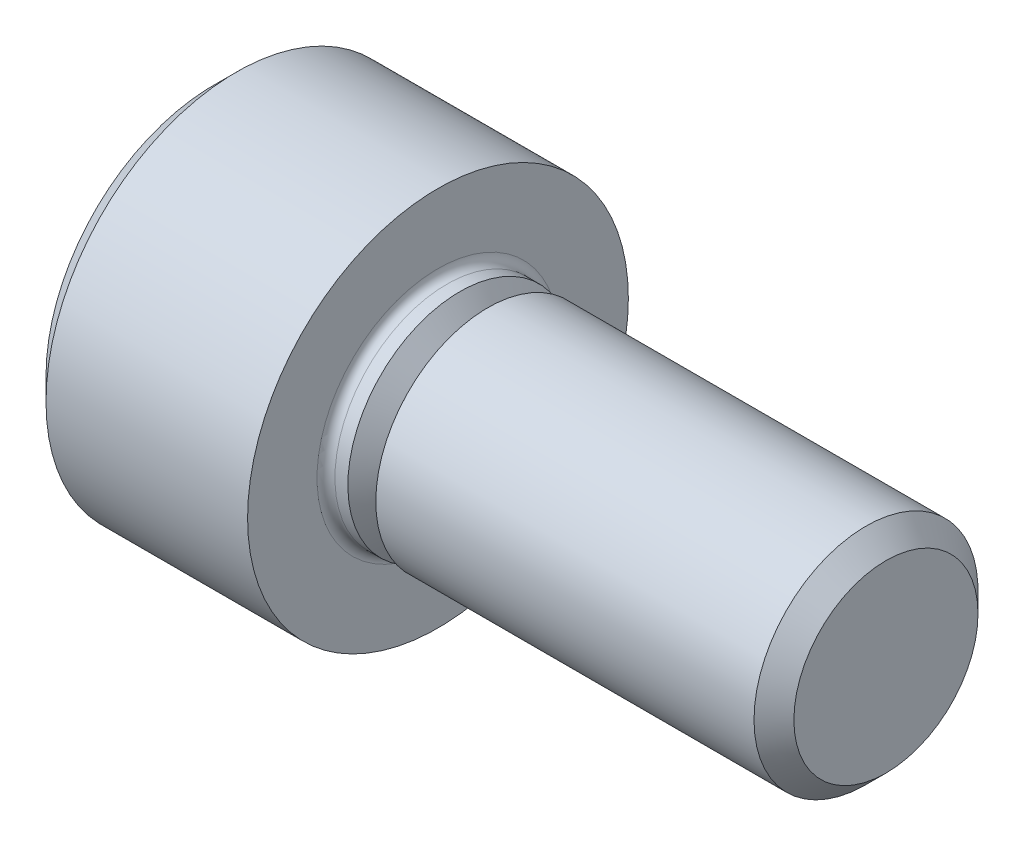
from build123d import *

# Parameters (mm, degrees)
FILLET1_R   = 0.2
HEX_2_DEPTH = 2.5


with BuildPart() as part:
    # BodySke → Base-Revolve (revolve)
    with BuildSketch(Plane.XY):
        Polygon((0, 0), (0, 3.75), (0.5, 4.25), (5, 4.25), (5, 2.5), (14.555, 2.5), (15, 2.055), (15, 0), align=None)
    revolve(axis=Axis((-31.75, 0, 0), (1, 0, 0)))

    # Fillet1
    fillet1_edges = [part.edges().sort_by_distance(p)[0] for p in [
        (5, -2.5, 0),
    ]]
    fillet(fillet1_edges, radius=FILLET1_R)

    # Sketch2 → Hex-PreBroach (revolve, cut)
    with BuildSketch(Plane.XY):
        Polygon((0, 2.042), (2.5, 2.042), (3.67894925, 0), (0, 0), align=None)
    revolve(axis=Axis((0, 0, 0), (1, 0, 0)), mode=Mode.SUBTRACT)

    # Sketch3 → Hex 2 (cut)
    with BuildSketch(Plane(origin=(0, 0, 0), x_dir=(0, 0.500000000000001, 0.866025403784438), z_dir=(-1, 0, 0))):
        Polygon((1.17894925, 2.042), (-1.17894925, 2.042), (-2.357898499, 0), (-1.17894925, -2.042), (1.17894925, -2.042), (2.357898499, 0), align=None)
    extrude(amount=-HEX_2_DEPTH, mode=Mode.SUBTRACT)

    # ThdSchSke → ThreadSchematic (revolve, cut)
    with BuildSketch(Plane.XY):
        Polygon((5.8, -2.055), (5.488407645, -2.5), (5.488407645, -3.125), (6.111592355, -3.125), (6.111592355, -2.5), align=None)
    revolve(axis=Axis((-3.175, 0, 0), (1, 0, 0)), mode=Mode.SUBTRACT)


solid = part.part
